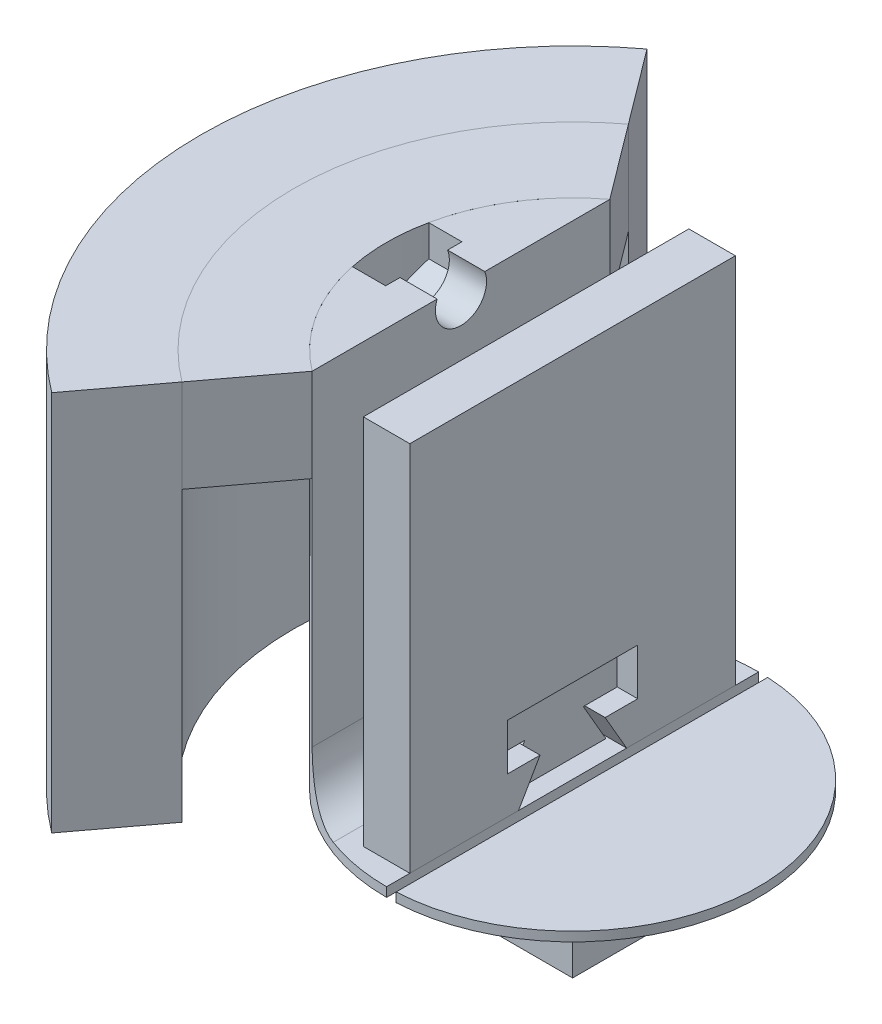
from build123d import *

# Parameters (mm, degrees)
SCHIZZO1_R                       = 20
ESTRUSIONE_ESTRUSIONE1_DEPTH     = 6
ESTRUSIONE_ESTRUSIONE2_DEPTH     = 40
RACCORDO1_R                      = 5
FORO_PER_VITE_M5_1_D             = 5.5
FORO_PER_VITE_M5_1_DEPTH         = 14
FORO_PER_VITE_M5_1_TIP           = 1.652366702
TAGLIO_ESTRUSIONE1_DEPTH         = 4
SCHIZZO9_W                       = 35
SCHIZZO9_H                       = 40
ESTRUSIONE_ESTRUSIONE3_DEPTH     = 5
SCHIZZO10_R                      = 2.5
ESTRUSIONE_ESTRUSIONE4_DEPTH     = 12
TAGLIO_ESTRUSIONE2_DEPTH         = 12
ESTRUSIONE_ESTRUSIONE5_DEPTH     = 10
SCHIZZO13_W                      = 1
SCHIZZO13_H                      = 40
TAGLIO_ESTRUSIONE_SOTTILE1_DEPTH = 1
SCHIZZO17_OUTSIDE_W              = 56.582
SCHIZZO17_OUTSIDE_H              = 56.582
SCHIZZO17_OUTSIDE_W_2            = 25
SCHIZZO17_OUTSIDE_H_2            = 25
TAGLIO_ESTRUSIONE3_DEPTH         = 5
RACCORDO2_R                      = 2
SMUSSO1_SIZE                     = 2
BOSS_EXTRUDE1_DEPTH              = 41
BOSS_EXTRUDE2_DEPTH              = 10


with BuildPart() as part:
    # Schizzo1 → Estrusione-Estrusione1 (new body)
    with BuildSketch(Plane(origin=(0, 0, 0), x_dir=(1, 0, 0), z_dir=(0, 1, 0))):
        with Locations(Location((0, 0, 0), (0, 0, 270))):
            Circle(SCHIZZO1_R)
    extrude(amount=ESTRUSIONE_ESTRUSIONE1_DEPTH)

    # Schizzo2 → Estrusione-Estrusione2 (add)
    with BuildSketch(Plane(origin=(0, 6, 0), x_dir=(1, 0, 0), z_dir=(0, 1, 0))):
        with BuildLine():
            Line((-12, 16), (-12, -16))
            ThreePointArc((-12, -16), (-20, 0), (-12, 16))
        make_face()
    extrude(amount=ESTRUSIONE_ESTRUSIONE2_DEPTH)

    # Raccordo1
    # the kernel refuses this fillet: 5 mm, written as the material it adds along each edge
    with BuildSketch(Plane(origin=(-12, 6, -28.5), x_dir=(1, 0, 0), z_dir=(0, 0, 1))) as raccordo1_piece_1_section:
        with BuildLine():
            CenterArc((RACCORDO1_R, RACCORDO1_R), RACCORDO1_R, 180, 90)
            Line((0, RACCORDO1_R), (0, 0))
            Line((0, 0), (RACCORDO1_R, 0))
        make_face()
    raccordo1_piece_1 = extrude(amount=57, mode=Mode.PRIVATE)
    raccordo1_piece_1 = raccordo1_piece_1 & Plane(origin=(0, 7.106421828, 0), x_dir=(0, 0, 1), z_dir=(0, -1, 0)) * Cylinder(20, 134, mode=Mode.PRIVATE)
    add(raccordo1_piece_1)

    # Foro per Vite M5-1
    with Locations(Plane.ZY.offset(20)):
        with Locations((0, 30), (0, 45)):
            Hole(FORO_PER_VITE_M5_1_D / 2, depth=FORO_PER_VITE_M5_1_DEPTH)
            with Locations((0, 0, -(FORO_PER_VITE_M5_1_DEPTH + FORO_PER_VITE_M5_1_TIP / 2))):  # 118° drill point
                Cone(0, FORO_PER_VITE_M5_1_D / 2, FORO_PER_VITE_M5_1_TIP, mode=Mode.SUBTRACT)

    # Schizzo8 → Taglio-Estrusione1 (cut)
    with BuildSketch(Plane.ZY.offset(20)):
        Polygon((0, 49.734272207), (-4.1, 47.367136104), (-4.1, 42.632863896), (0, 40.265727793), (4.1, 42.632863896), (4.1, 47.367136104), align=None)
    extrude(amount=-TAGLIO_ESTRUSIONE1_DEPTH, mode=Mode.SUBTRACT)

    # Schizzo12 → Estrusione-Estrusione5 (add)
    with BuildSketch(Plane(origin=(-12, 0, 0), x_dir=(0, 0, -1), z_dir=(1, 0, 0))):
        Polygon((5.578460969, 6), (3.153589838, 10.2), (6.8, 10.2), (6.8, 14.8), (-6.8, 14.8), (-6.8, 10.2), (-3.153589838, 10.2), (-5.578460969, 6), align=None)
    extrude(amount=ESTRUSIONE_ESTRUSIONE5_DEPTH)

    # Schizzo13 → Taglio-Estrusione-Sottile1 (cut)
    with BuildSketch(Plane(origin=(0, 6, 0), x_dir=(1, 0, 0), z_dir=(0, 1, 0))):
        with Locations((0.5, 0)):
            Rectangle(SCHIZZO13_W, SCHIZZO13_H)
    extrude(amount=-TAGLIO_ESTRUSIONE_SOTTILE1_DEPTH, mode=Mode.SUBTRACT)

    # Schizzo17 outside → Taglio-Estrusione3 (cut)
    with BuildSketch(Plane.XZ):
        Rectangle(SCHIZZO17_OUTSIDE_W, SCHIZZO17_OUTSIDE_H)
        Rectangle(SCHIZZO17_OUTSIDE_W_2, SCHIZZO17_OUTSIDE_H_2, mode=Mode.SUBTRACT)
    extrude(amount=-TAGLIO_ESTRUSIONE3_DEPTH, mode=Mode.SUBTRACT)

    # Smusso1
    smusso1_edges = [part.edges().sort_by_distance(p)[0] for p in [
        (-12, 30, 2.75),
    ]]
    chamfer(smusso1_edges, length=SMUSSO1_SIZE)


with BuildPart() as body_2:
    # Schizzo9 → Estrusione-Estrusione3 (new body)
    with BuildSketch(Plane(origin=(0, 0, 0), x_dir=(0, 0, -1), z_dir=(1, 0, 0))):
        with Locations((0, 26)):
            Rectangle(SCHIZZO9_W, SCHIZZO9_H)
    extrude(amount=-ESTRUSIONE_ESTRUSIONE3_DEPTH)

    # Schizzo10 → Estrusione-Estrusione4 (add)
    with BuildSketch(Plane.ZY.offset(5)):
        with Locations(Location((0, 21, 0), (0, 0, 180))):
            Circle(SCHIZZO10_R)
    extrude(amount=ESTRUSIONE_ESTRUSIONE4_DEPTH)

    # Schizzo11 → Taglio-Estrusione2 (cut)
    with BuildSketch(Plane(origin=(0, 0, 0), x_dir=(0, 0, -1), z_dir=(1, 0, 0))):
        Polygon((-5.809401077, 6), (-3.5, 10), (-7, 10), (-7, 15), (7, 15), (7, 10), (3.5, 10), (5.809401077, 6), align=None)
    extrude(amount=-TAGLIO_ESTRUSIONE2_DEPTH, mode=Mode.SUBTRACT)

    # Raccordo2
    raccordo2_edges = [body_2.edges().sort_by_distance(p)[0] for p in [
        (-5, 21, 2.5),
    ]]
    fillet(raccordo2_edges, radius=RACCORDO2_R)


with BuildPart() as body_3:
    # Sketch1 → Boss-Extrude1 (new body)
    with BuildSketch(Plane(origin=(0, 46, 0), x_dir=(1, 0, 0), z_dir=(0, 1, 0))):
        with BuildLine():
            Line((-24, 32), (-18, 24))
            ThreePointArc((-18, 24), (-30, 0), (-18, -24))
            Line((-18, -24), (-24, -32))
            ThreePointArc((-24, -32), (-40, 0), (-24, 32))
        make_face()
    extrude(amount=-BOSS_EXTRUDE1_DEPTH)


with BuildPart() as body_4:
    # Sketch2 → Boss-Extrude2 (new body)
    with BuildSketch(Plane(origin=(0, 46, 0), x_dir=(1, 0, 0), z_dir=(0, 1, 0))):
        with BuildLine():
            Line((-12, 16), (-18, 24))
            ThreePointArc((-18, 24), (-30, 0), (-18, -24))
            Line((-18, -24), (-12, -16))
            ThreePointArc((-12, -16), (-20, 0), (-12, 16))
        make_face()
    extrude(amount=-BOSS_EXTRUDE2_DEPTH)


solid = Compound([part.part, body_2.part, body_3.part, body_4.part])
